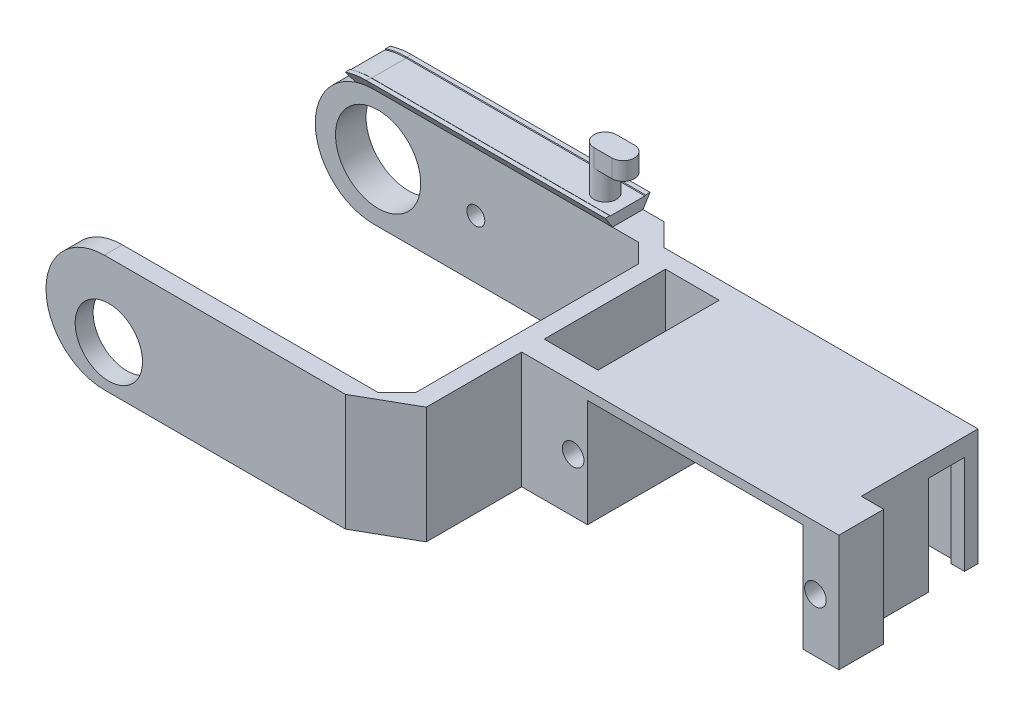
from build123d import *

# Parameters (mm, degrees)
BOSS_EXTRUDE1_DEPTH = 65
BOSS_EXTRUDE2_DEPTH = 65
SKETCH5_W           = 30
SKETCH5_H           = 67.5
CUT_EXTRUDE1_DEPTH  = 65
SKETCH7_W           = 120
SKETCH7_H           = 85
CUT_EXTRUDE2_DEPTH  = 60
CUT_EXTRUDE3_REACH  = 236.375
SKETCH8_R           = 6
FILLET1_R           = 32.5
SKETCH9_R           = 18.75
CUT_EXTRUDE4_DEPTH  = 10
CUT_EXTRUDE5_START  = -17
SKETCH10_R          = 23.75
SKETCH10_R_2        = 5
CUT_EXTRUDE5_DEPTH  = 17
SKETCH11_W          = 20
SKETCH11_H          = 55
CUT_EXTRUDE6_DEPTH  = 20
SKETCH12_R          = 20
CUT_EXTRUDE7_DEPTH  = 5
SKETCH13_R          = 30
BOSS_EXTRUDE3_DEPTH = 2.5
SKETCH14_R          = 15
BOSS_EXTRUDE4_DEPTH = 15
SKETCH17_R          = 6.25
BOSS_EXTRUDE5_DEPTH = 15
BOSS_EXTRUDE6_DEPTH = 10


with BuildPart() as part:
    # Sketch2 → Boss-Extrude1 (new body)
    with BuildSketch(Plane(origin=(0, 0, 0), x_dir=(1, 0, 0), z_dir=(0, 1, 0))):
        Polygon((0, 66.142135624), (0, -66.142135624), (-28.698430784, -82.5), (-195.5, -82.5), (-195.5, -72.5), (-20.5, -72.5), (-10, -62), (-10, 62), (-20.5, 72.5), (-200.5, 72.5), (-200.5, 89.5), (-23.357864376, 89.5), align=None)
    extrude(amount=BOSS_EXTRUDE1_DEPTH)

    # Sketch3 → Boss-Extrude2 (add)
    with BuildSketch(Plane(origin=(0, 0, 0), x_dir=(1, 0, 0), z_dir=(0, 1, 0))):
        Polygon((164.142135624, 77), (164.142135624, 12), (176.642135624, 12), (176.642135624, -13), (0, -13), (0, 66.142135624), (-10.857864376, 77), align=None)
    extrude(amount=BOSS_EXTRUDE2_DEPTH)

    # Sketch5 → Cut-Extrude1 (cut)
    with BuildSketch(Plane(origin=(0, 0, 0), x_dir=(-1, 0, 0), z_dir=(0, -1, 0))):
        with Locations((-15, 33.25)):
            Rectangle(SKETCH5_W, SKETCH5_H)
    extrude(amount=-CUT_EXTRUDE1_DEPTH, mode=Mode.SUBTRACT)

    # Sketch7 → Cut-Extrude2 (cut)
    with BuildSketch(Plane(origin=(0, 0, 0), x_dir=(-1, 0, 0), z_dir=(0, -1, 0))):
        with Locations((-96.642135624, 29.5)):
            Rectangle(SKETCH7_W, SKETCH7_H)
    extrude(amount=-CUT_EXTRUDE2_DEPTH, mode=Mode.SUBTRACT)

    # Cut-Extrude3: up to this face of the body (flat: up to its plane)
    cut_extrude3_end = Plane(part.part.faces().sort_by_distance((170.392135624, 32.5, -12))[0])
    # Sketch8 → Cut-Extrude3 (cut, up to the picked face)
    with BuildSketch(Plane.XY.offset(13), mode=Mode.PRIVATE) as cut_extrude3_sk1:
        with Locations((28.642135624, 30)):
            Circle(SKETCH8_R)
    cut_extrude3_tool1 = split(extrude(cut_extrude3_sk1.sketch, amount=-CUT_EXTRUDE3_REACH, mode=Mode.PRIVATE), bisect_by=cut_extrude3_end, keep=Keep.BOTH, mode=Mode.PRIVATE)
    # Sketch8 → Cut-Extrude3 (cut, up to the picked face)
    with BuildSketch(Plane.XY.offset(13), mode=Mode.PRIVATE) as cut_extrude3_sk2:
        with Locations((163.592135624, 30)):
            Circle(SKETCH8_R)
    cut_extrude3_tool2 = split(extrude(cut_extrude3_sk2.sketch, amount=-CUT_EXTRUDE3_REACH, mode=Mode.PRIVATE), bisect_by=cut_extrude3_end, keep=Keep.BOTH, mode=Mode.PRIVATE)
    add(cut_extrude3_tool1.solids().sort_by(Axis((28.642136, 30, 13), (0, 0, -1)))[0], mode=Mode.SUBTRACT)
    add(cut_extrude3_tool2.solids().sort_by(Axis((163.592136, 30, 13), (0, 0, -1)))[0], mode=Mode.SUBTRACT)

    # Fillet1
    fillet1_edges = [part.edges().sort_by_distance(p)[0] for p in [
        (-195.5, 65, 77.5),
        (-195.5, 0, 77.5),
        (-200.5, 0, -81),
        (-200.5, 65, -81),
    ]]
    fillet(fillet1_edges, radius=FILLET1_R - 0.0001)  # a hair under: the kernel refuses the full size

    # Sketch9 → Cut-Extrude4 (cut)
    with BuildSketch(Plane.XY.offset(82.5)):
        with Locations((-160.5, 24.2)):
            Circle(SKETCH9_R)
    extrude(amount=-CUT_EXTRUDE4_DEPTH, mode=Mode.SUBTRACT)

    # Sketch10 → Cut-Extrude5 (cut)
    with BuildSketch(Plane(origin=(0, 0, -89.5), x_dir=(-1, 0, 0), z_dir=(0, 0, -1)).offset(CUT_EXTRUDE5_START)):
        with Locations((165.5, 32.5)):
            Circle(SKETCH10_R)
        with Locations((111.08276356, 32.5)):
            Circle(SKETCH10_R_2)
    extrude(amount=CUT_EXTRUDE5_DEPTH, mode=Mode.SUBTRACT)

    # Sketch11 → Cut-Extrude6 (cut)
    with BuildSketch(Plane(origin=(176.642135624, 0, 0), x_dir=(0, 0, -1), z_dir=(1, 0, 0))):
        with Locations((59.5, 27.5)):
            Rectangle(SKETCH11_W, SKETCH11_H)
    extrude(amount=-CUT_EXTRUDE6_DEPTH, mode=Mode.SUBTRACT)

    # Sketch12 → Cut-Extrude7 (cut)
    with BuildSketch(Plane(origin=(0, 0, -77), x_dir=(-1, 0, 0), z_dir=(0, 0, -1))):
        with Locations((-64.142135624, 32.5)):
            Circle(SKETCH12_R)
    extrude(amount=-CUT_EXTRUDE7_DEPTH, mode=Mode.SUBTRACT)

    # Sketch13 → Boss-Extrude3 (add)
    with BuildSketch(Plane(origin=(0, 0, -77), x_dir=(-1, 0, 0), z_dir=(0, 0, -1))):
        with Locations(Location((-117.036013704, 32.225, 0), (0, 0, 180))):
            Circle(SKETCH13_R)
    extrude(amount=BOSS_EXTRUDE3_DEPTH)

    # Sketch14 → Boss-Extrude4 (add)
    with BuildSketch(Plane(origin=(0, 0, -79.5), x_dir=(-1, 0, 0), z_dir=(0, 0, -1))):
        with Locations((-117.036013704, 32.225)):
            Circle(SKETCH14_R)
    extrude(amount=BOSS_EXTRUDE4_DEPTH)

    # Sweep1: sweep along a path in Sketch16
    with BuildLine(Plane(origin=(0, 0, 72.5), x_dir=(-1, 0, 0), z_dir=(0, 0, -1))) as sweep1_path:
        Line((35, 65), (168, 65))
        ThreePointArc((168, 65), (173, 64.613081447), (177.880948137, 63.461538462))
    # Sketch15 → Sweep1 (sweep)
    with BuildSketch(Plane.ZY.offset(35)):
        Polygon((-89.5, 65), (-72.5, 65), (-68.5, 71.278742308), (-71, 71.278742308), (-71.398085272, 71), (-90.601914728, 71), (-91, 71.278742308), (-93.5, 71.278742308), align=None)
    sweep(path=sweep1_path.line)

    # Sketch17 → Boss-Extrude5 (add)
    with BuildSketch(Plane(origin=(0, 71, 0), x_dir=(1, 0, 0), z_dir=(0, 1, 0))):
        with Locations(Location((-47.5, 81, 0), (0, 0, 270))):
            Circle(SKETCH17_R)
    extrude(amount=BOSS_EXTRUDE5_DEPTH)

    # Sketch18 → Boss-Extrude6 (add)
    with BuildSketch(Plane(origin=(0, 86, 0), x_dir=(1, 0, 0), z_dir=(0, 1, 0))):
        with BuildLine():
            Line((-47.5, 87.25), (-37.5, 87.25))
            ThreePointArc((-37.5, 87.25), (-31.25, 81), (-37.5, 74.75))
            Line((-37.5, 74.75), (-47.5, 74.75))
            ThreePointArc((-47.5, 74.75), (-53.75, 81), (-47.5, 87.25))
        make_face()
    extrude(amount=BOSS_EXTRUDE6_DEPTH)


solid = part.part
